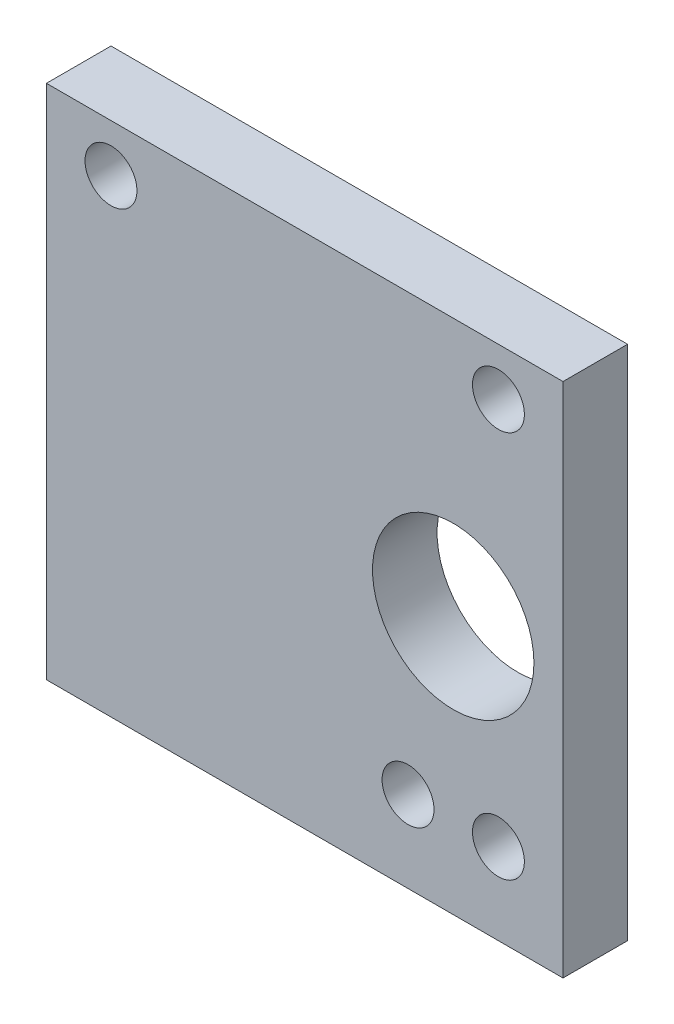
from build123d import *

# Parameters (mm, degrees)
SKETCH1_W           = 50.8
SKETCH1_H           = 50.8
SKETCH1_R           = 2.5527
SKETCH1_R_2         = 7.9375
BOSS_EXTRUDE1_DEPTH = 6.35


with BuildPart() as part:
    # Sketch1 → Boss-Extrude1 (new body)
    with BuildSketch(Plane.XY):
        Rectangle(SKETCH1_W, SKETCH1_H)
        with Locations((-19.05, 20.701)):
            Circle(SKETCH1_R, mode=Mode.SUBTRACT)
        with Locations((19.05, 20.701)):
            Circle(SKETCH1_R, mode=Mode.SUBTRACT)
        with Locations((19.05, -17.399)):
            Circle(SKETCH1_R, mode=Mode.SUBTRACT)
        with Locations((10.16, -17.399)):
            Circle(SKETCH1_R, mode=Mode.SUBTRACT)
        with Locations((14.605, 0)):
            Circle(SKETCH1_R_2, mode=Mode.SUBTRACT)
    extrude(amount=BOSS_EXTRUDE1_DEPTH)


solid = part.part
